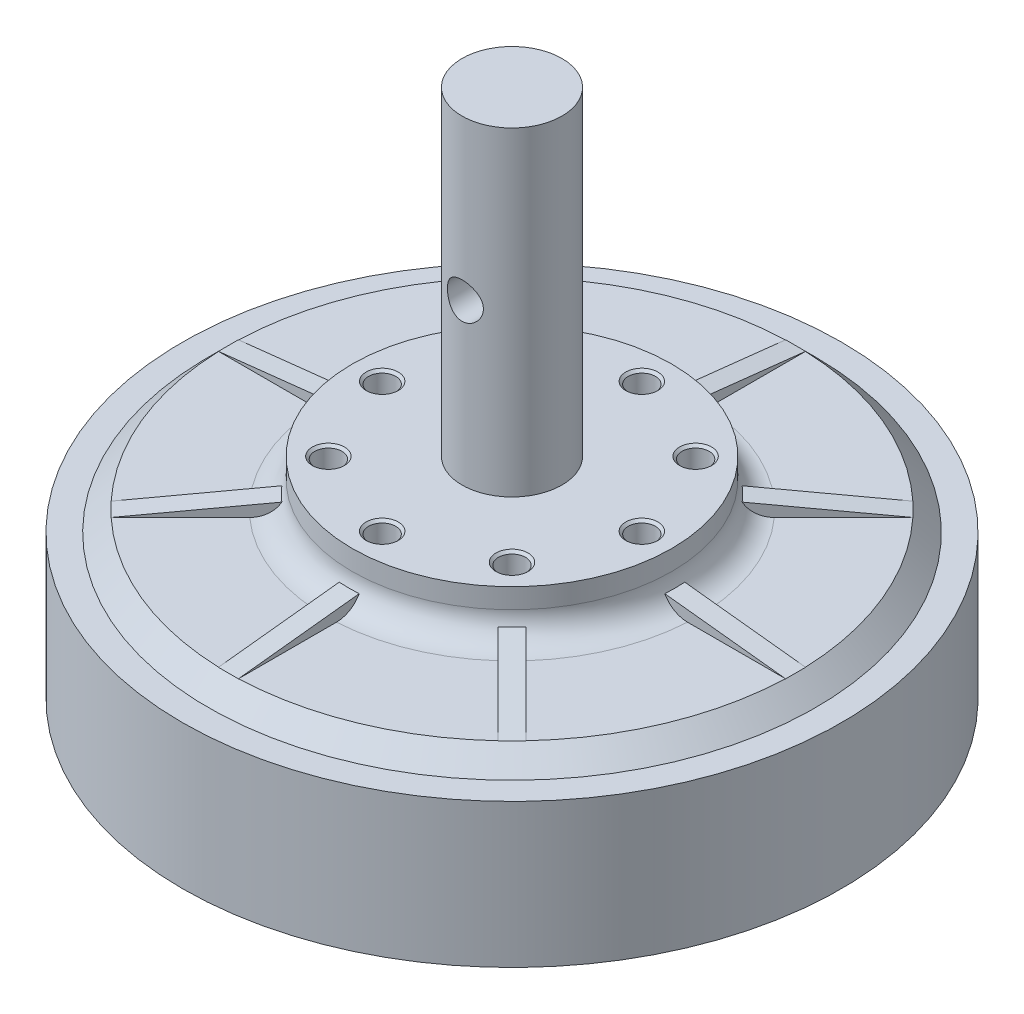
from build123d import *

# Parameters (mm, degrees)
SKETCH1_W                        = 12.5
SKETCH1_H                        = 80
SKETCH1_W_2                      = 40
SKETCH1_H_2                      = 69
FILLET1_R                        = 6.5
CUT_EXTRUDE1_DEPTH               = 190.24455078
CUT_EXTRUDE1_DEPTH_BACK          = 190.24455078
SKETCH3_R                        = 4.5
M8X1_25_TAPPED_HOLE1_D           = 6.8
M8X1_25_TAPPED_HOLE1_DEPTH       = 19.75
M8X1_25_TAPPED_HOLE1_CSINK_D     = 8.05
M8X1_25_TAPPED_HOLE1_CSINK_ANGLE = 90
M8X1_25_TAPPED_HOLE1_TIP         = 2.042926105
FILLET2_R                        = 6.5
M8X1_25_TAPPED_HOLE2_D           = 6.8
M8X1_25_TAPPED_HOLE2_DEPTH       = 22.25
M8X1_25_TAPPED_HOLE2_CSINK_D     = 8.05
M8X1_25_TAPPED_HOLE2_CSINK_ANGLE = 90
M8X1_25_TAPPED_HOLE2_TIP         = 2.042926105
RIB5_START                       = -2.5
RIB5_DEPTH                       = 5
CIRPATTERN1_COUNT                = 8


# Read off the part's stored shape, not the designer's step: Rib5
with BuildPart() as part:
    # Sketch1 → Revolve1 (revolve)
    with BuildSketch(Plane.XY, mode=Mode.PRIVATE) as revolve1_sk:
        with Locations((-6.25, 109)):
            Rectangle(SKETCH1_W, SKETCH1_H)
        with Locations((-20, 34.5)):
            Rectangle(SKETCH1_W_2, SKETCH1_H_2)
        Polygon((-71, 11.5), (-40, 11.5), (-40, 57.5), (-71, 57.5), (-71, 52.5), (-71, 16.5), align=None)
        Polygon((-76, 16.5), (-71, 11.5), (-71, 16.5), align=None)
        Polygon((-76, 16.5), (-71, 16.5), (-71, 52.5), (-76, 52.5), (-82.5, 52.5), (-82.5, 16.5), align=None)
        Polygon((-71, 52.5), (-71, 57.5), (-76, 52.5), align=None)
    revolve(revolve1_sk.sketch.rotate(Axis((0, 0, 0), (0, 1, 0)), 270), axis=Axis((0, 0, 0), (0, 1, 0)))

    # Fillet1
    fillet1_edges = [part.edges().sort_by_distance(p)[0] for p in [
        (0, 57.5, 40),
    ]]
    fillet(fillet1_edges, radius=FILLET1_R)

    # Sketch3 → Cut-Extrude1 (cut, two sides: drawn at the far end of the back side and taken through both)
    with BuildSketch(Plane.XY.offset(-CUT_EXTRUDE1_DEPTH_BACK)):
        with Locations((0, 109)):
            Circle(SKETCH3_R)
    extrude(amount=CUT_EXTRUDE1_DEPTH + CUT_EXTRUDE1_DEPTH_BACK, mode=Mode.SUBTRACT)

    # M8x1.25 Tapped Hole1
    with Locations(Plane(origin=(0, 69, 0), x_dir=(1, 0, 0), z_dir=(0, 1, 0))):
        with Locations((-32.5, 0), (-22.980970389, 22.980970389), (0, 32.5), (22.980970389, 22.980970389), (32.5, 0), (22.980970389, -22.980970389), (0, -32.5), (-22.980970389, -22.980970389)):
            CounterSinkHole(M8X1_25_TAPPED_HOLE1_D / 2, M8X1_25_TAPPED_HOLE1_CSINK_D / 2, depth=M8X1_25_TAPPED_HOLE1_DEPTH, counter_sink_angle=M8X1_25_TAPPED_HOLE1_CSINK_ANGLE)
            with Locations((0, 0, -(M8X1_25_TAPPED_HOLE1_DEPTH + M8X1_25_TAPPED_HOLE1_TIP / 2))):  # 118° drill point
                Cone(0, M8X1_25_TAPPED_HOLE1_D / 2, M8X1_25_TAPPED_HOLE1_TIP, mode=Mode.SUBTRACT)

    # Fillet2
    fillet2_edges = [part.edges().sort_by_distance(p)[0] for p in [
        (0, 11.5, 40),
    ]]
    fillet(fillet2_edges, radius=FILLET2_R)

    # M8x1.25 Tapped Hole2
    with Locations(Plane(origin=(0, 0, 0), x_dir=(-1, 0, 0), z_dir=(0, -1, 0))):
        with Locations((-22.980970389, 22.980970389), (0, 32.5), (22.980970389, 22.980970389), (32.5, 0), (-32.5, 0), (22.980970389, -22.980970389), (0, -32.5), (-22.980970389, -22.980970389)):
            CounterSinkHole(M8X1_25_TAPPED_HOLE2_D / 2, M8X1_25_TAPPED_HOLE2_CSINK_D / 2, depth=M8X1_25_TAPPED_HOLE2_DEPTH, counter_sink_angle=M8X1_25_TAPPED_HOLE2_CSINK_ANGLE)
            with Locations((0, 0, -(M8X1_25_TAPPED_HOLE2_DEPTH + M8X1_25_TAPPED_HOLE2_TIP / 2))):  # 118° drill point
                Cone(0, M8X1_25_TAPPED_HOLE2_D / 2, M8X1_25_TAPPED_HOLE2_TIP, mode=Mode.SUBTRACT)

    # Rib5 outline → Rib5 (add)
    with BuildSketch(Plane.XY.offset(RIB5_START)):
        Polygon((-40.745972334, 60.835024122), (-71, 57.5), (-39, 57.5), (-39, 61.027489731), align=None)
    rib5 = extrude(amount=RIB5_DEPTH)

    # CirPattern1: Rib5 ×8 about axis
    cirpattern1_axis = Axis((0, 0, 0), (0, 1, 0))
    for i in range(1, CIRPATTERN1_COUNT):
        add(rib5.rotate(cirpattern1_axis, i * 360 / CIRPATTERN1_COUNT))


solid = part.part
